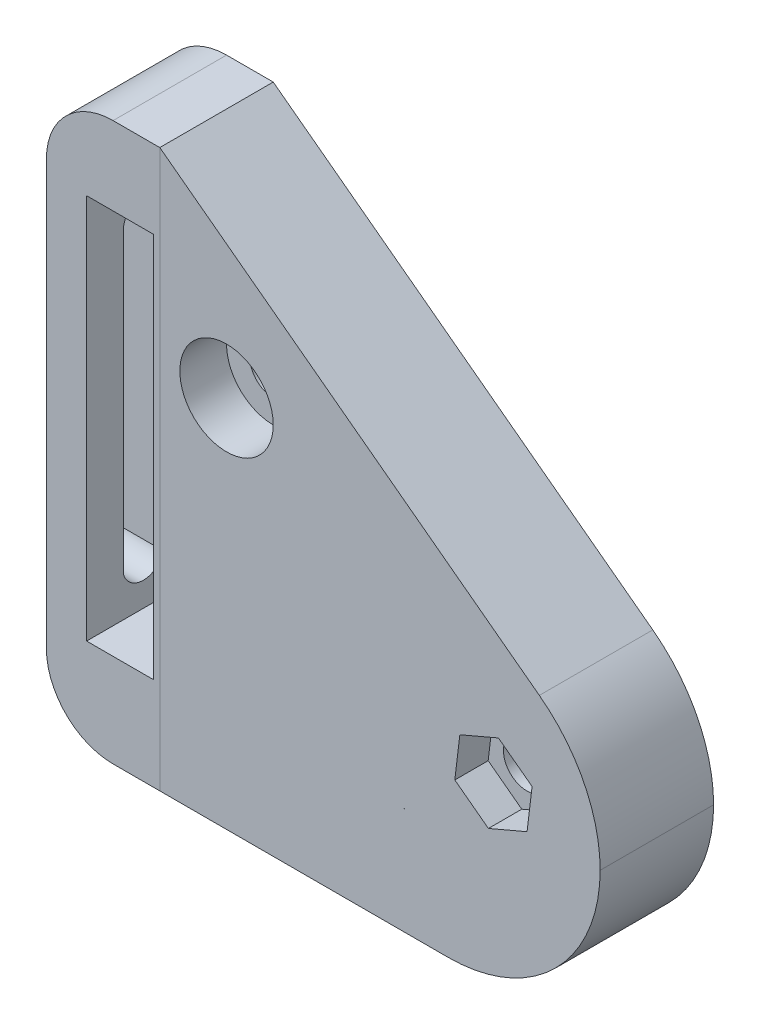
from build123d import *

# Parameters (mm, degrees)
SKETCH1_R           = 1.75
BOSS_EXTRUDE1_DEPTH = 8.5
CUT_EXTRUDE2_DEPTH  = 2.5
CUT_EXTRUDE3_DEPTH  = 2.5
SKETCH5_R           = 3.5
CUT_EXTRUDE4_DEPTH  = 3.5
SKETCH6_R           = 3.5
CUT_EXTRUDE5_DEPTH  = 3.5
FILLET1_R           = 11.4
SKETCH7_W           = 8.501662988
SKETCH7_H           = 41.75
BOSS_EXTRUDE3_DEPTH = 8.5
SKETCH8_W           = 5
SKETCH8_H           = 28.902484154
CUT_EXTRUDE6_DEPTH  = 44.858046851
CUT_EXTRUDE7_REACH  = 52.235
FILLET2_R           = 5
FILLET3_R           = 5


with BuildPart() as part:
    # Sketch1 → Boss-Extrude1 (new body)
    with BuildSketch(Plane.XY):
        Polygon((8, -10), (8, -27), (-25, -27), (-25, 14.75), align=None)
        with Locations((-20, 1)):
            Circle(SKETCH1_R, mode=Mode.SUBTRACT)
        with Locations((0, -14)):
            Circle(SKETCH1_R, mode=Mode.SUBTRACT)
        Polygon((-6.687894354, -19), (-6.666666667, -19), (-6.687894354, -18.984079234), align=None, mode=Mode.SUBTRACT)
    extrude(amount=BOSS_EXTRUDE1_DEPTH)

    # Sketch3 → Cut-Extrude2 (cut)
    with BuildSketch(Plane(origin=(0, 0, 0), x_dir=(-1, 0, 0), z_dir=(0, 0, -1))):
        Polygon((22.725, 2.573279484), (20, 4.146558967), (17.275, 2.573279484), (17.275, -0.573279484), (20, -2.146558967), (22.725, -0.573279484), align=None)
    extrude(amount=-CUT_EXTRUDE2_DEPTH, mode=Mode.SUBTRACT)

    # Sketch4 → Cut-Extrude3 (cut)
    with BuildSketch(Plane.XY.offset(8.5)):
        Polygon((-2.517247174, -12.11206462), (-2.893623587, -15.23603231), (-0.376376413, -17.12396769), (2.517247174, -15.88793538), (2.893623587, -12.76396769), (0.376376413, -10.87603231), align=None)
    extrude(amount=-CUT_EXTRUDE3_DEPTH, mode=Mode.SUBTRACT)

    # Sketch5 → Cut-Extrude4 (cut)
    with BuildSketch(Plane.XY.offset(8.5)):
        with Locations((-20, 1)):
            Circle(SKETCH5_R)
    extrude(amount=-CUT_EXTRUDE4_DEPTH, mode=Mode.SUBTRACT)

    # Sketch6 → Cut-Extrude5 (cut)
    with BuildSketch(Plane(origin=(0, 0, 0), x_dir=(-1, 0, 0), z_dir=(0, 0, -1))):
        with Locations((0, -14)):
            Circle(SKETCH6_R)
    extrude(amount=-CUT_EXTRUDE5_DEPTH, mode=Mode.SUBTRACT)

    # Fillet1
    # the kernel refuses this fillet: 11.4 mm, written as the material it takes off along each edge
    with BuildSketch(Plane(origin=(8, -10, -14.25), x_dir=(0, -1, 0), z_dir=(0, 0, 1))) as fillet1_piece_1:
        with BuildLine():
            CenterArc((FILLET1_R * 0.5, -FILLET1_R), FILLET1_R, 90, 53.130102354)
            Line((-FILLET1_R * 0.3, -FILLET1_R * 0.4), (0, 0))
            Line((0, 0), (FILLET1_R * 0.5, 0))
        make_face()
    extrude(amount=37, mode=Mode.SUBTRACT)
    with BuildSketch(Plane(origin=(8, -27, -28.5), x_dir=(0, 1, 0), z_dir=(0, 0, 1))) as fillet1_piece_2:
        with BuildLine():
            CenterArc((FILLET1_R, FILLET1_R), FILLET1_R, 180, 90)
            Line((0, FILLET1_R), (0, 0))
            Line((0, 0), (FILLET1_R, 0))
        make_face()
    extrude(amount=65.5, mode=Mode.SUBTRACT)

    # Sketch7 → Boss-Extrude3 (add)
    with BuildSketch(Plane.ZY.offset(25)):
        with Locations((4.25, -6.125)):
            Rectangle(SKETCH7_W, SKETCH7_H)
    extrude(amount=BOSS_EXTRUDE3_DEPTH)

    # Sketch8 → Cut-Extrude6 (cut, through all)
    with BuildSketch(Plane.XY.offset(8.500831494)):
        with Locations((-27.983222081, -5.565864812)):
            Rectangle(SKETCH8_W, SKETCH8_H)
    extrude(amount=-CUT_EXTRUDE6_DEPTH, mode=Mode.SUBTRACT)

    # Sketch9 → Cut-Extrude7 (cut, up to next)
    with BuildSketch(Plane.ZY.offset(33.5), mode=Mode.PRIVATE) as cut_extrude7_sk1:
        with BuildLine():
            Line((5.75, -17.038286927), (5.75, 5.275984322))
            ThreePointArc((5.75, 5.275984322), (4.25, 6.775984322), (2.75, 5.275984322))
            Line((2.75, 5.275984322), (2.75, -17.038286927))
            ThreePointArc((2.75, -17.038286927), (4.25, -18.194874392), (5.75, -17.038286927))
        make_face()
    cut_extrude7_tool1 = extrude(cut_extrude7_sk1.sketch, amount=-CUT_EXTRUDE7_REACH, mode=Mode.PRIVATE) & part.part
    add(cut_extrude7_tool1.solids().sort_by_distance((-33.5, -5.719772, 4.25))[0], mode=Mode.SUBTRACT)

    # Fillet2
    fillet2_edges = [part.edges().sort_by_distance(p)[0] for p in [
        (-33.5, -27, 4.25),
    ]]
    fillet(fillet2_edges, radius=FILLET2_R)

    # Fillet3
    fillet3_edges = [part.edges().sort_by_distance(p)[0] for p in [
        (-33.5, 14.75, 4.25),
    ]]
    fillet(fillet3_edges, radius=FILLET3_R)


solid = part.part
